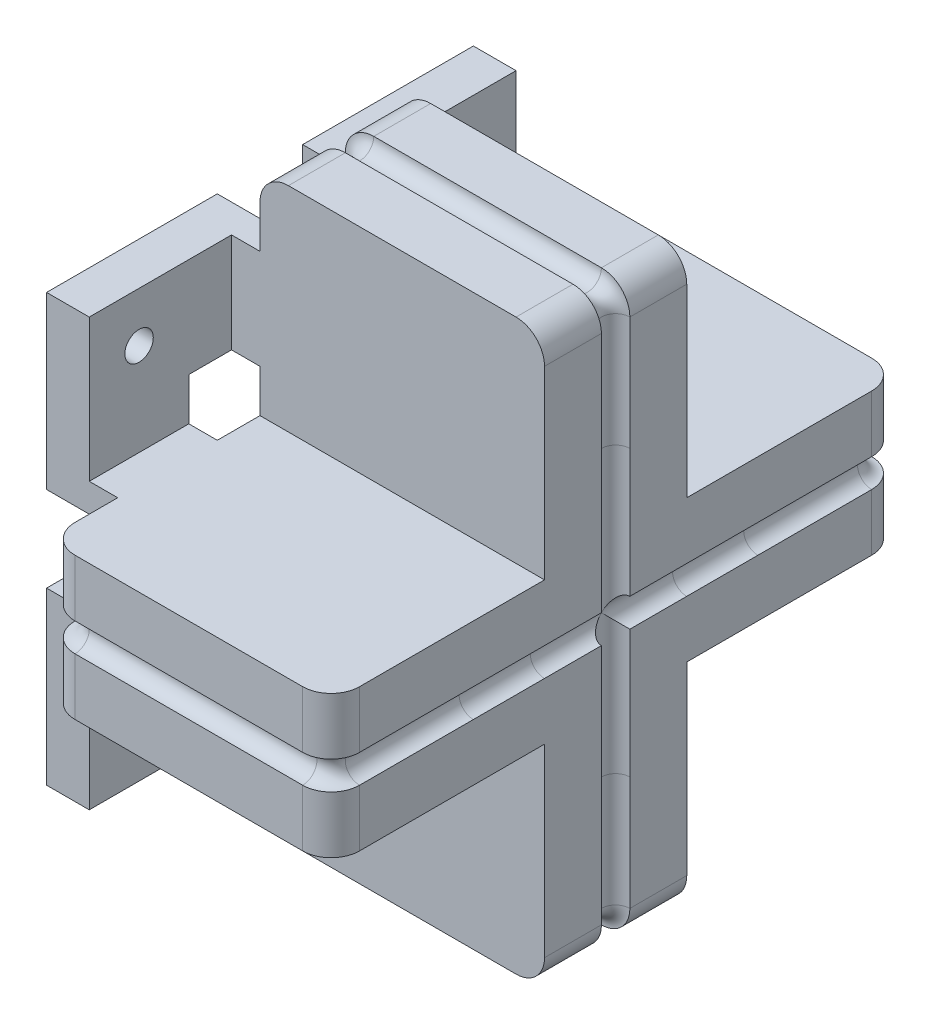
from build123d import *

# Parameters (mm, degrees)
BOSS_EXTRUDE1_DEPTH                   = 5
BOSS_EXTRUDE3_DEPTH                   = 5
SKETCH24_R                            = 1
SKETCH29_R                            = 1
BOSS_EXTRUDE7_REACH                   = 32
BOSS_EXTRUDE7_END_RADIUS              = 1
SKETCH27_R                            = 1
BOSS_EXTRUDE10_REACH                  = 32
BOSS_EXTRUDE10_END_RADIUS             = 1
SKETCH31_R                            = 1
BOSS_EXTRUDE10_DIRECTION_2_REACH      = 32
BOSS_EXTRUDE10_DIRECTION_2_END_RADIUS = 1
BOSS_EXTRUDE11_REACH                  = 32
BOSS_EXTRUDE11_END_RADIUS             = 1
SKETCH32_R                            = 1
SKETCH34_W                            = 7
SKETCH34_H                            = 2
SKETCH34_W_2                          = 2
SKETCH34_H_2                          = 7
BOSS_EXTRUDE12_DEPTH                  = 5
BOSS_EXTRUDE13_DEPTH                  = 3
M1_6_CLEARANCE_HOLE1_D                = 2


with BuildPart() as part:
    # Sketch1 → Boss-Extrude1 (new, symmetric)
    with BuildSketch(Plane.XY):
        with BuildLine():
            Line((8, 20), (0, 20))
            Line((0, 20), (0, -20))
            Line((0, -20), (8, -20))
            ThreePointArc((8, -20), (9.414213562, -19.414213562), (10, -18))
            Line((10, -18), (10, -10))
            Line((10, -10), (10, 10))
            Line((10, 10), (10, 18))
            ThreePointArc((10, 18), (9.414213562, 19.414213562), (8, 20))
        make_face()
    extrude(amount=BOSS_EXTRUDE1_DEPTH, both=True)

    # Sketch26 → Boss-Extrude3 (add, symmetric)
    with BuildSketch(Plane(origin=(0, 0, 0), x_dir=(1, 0, 0), z_dir=(0, 1, 0))):
        with BuildLine():
            Line((0, 20), (0, 5))
            Line((0, 5), (0, -5))
            Line((0, -5), (0, -20))
            Line((0, -20), (8, -20))
            ThreePointArc((8, -20), (9.414213562, -19.414213562), (10, -18))
            Line((10, -18), (10, -10))
            Line((10, -10), (10, -5))
            Line((10, -5), (10, 5))
            Line((10, 5), (10, 10))
            Line((10, 10), (10, 18))
            ThreePointArc((10, 18), (9.414213562, 19.414213562), (8, 20))
            Line((8, 20), (0, 20))
        make_face()
    extrude(amount=BOSS_EXTRUDE3_DEPTH, both=True)

    # Cut-Sweep3: sweep along a path in Sketch1<5>
    with BuildLine(Plane.XY) as cut_sweep3_path:
        Line((0, 20), (0, -20))
        Line((0, -20), (8, -20))
        ThreePointArc((8, -20), (9.414213562, -19.414213562), (10, -18))
        Line((10, -18), (10, -10))
        Line((10, -10), (10, 10))
        Line((10, 10), (10, 18))
        ThreePointArc((10, 18), (9.414213562, 19.414213562), (8, 20))
        Line((8, 20), (0, 20))
    # Sketch24 → Cut-Sweep3 (sweep, cut)
    with BuildSketch(Plane(origin=(0, 0, 0), x_dir=(1, 0, 0), z_dir=(0, 1, 0))):
        with Locations((10, 0)):
            Circle(SKETCH24_R)
    sweep(path=cut_sweep3_path.line, transition=Transition.RIGHT, mode=Mode.SUBTRACT)

    # Cut-Sweep6: sweep along a path in Sketch26<7>
    with BuildLine(Plane(origin=(0, 0, 0), x_dir=(1, 0, 0), z_dir=(0, 1, 0))) as cut_sweep6_path:
        Line((0, 5), (0, 20))
        Line((0, 20), (8, 20))
        ThreePointArc((8, 20), (9.414213562, 19.414213562), (10, 18))
        Line((10, 18), (10, 10))
        Line((10, 10), (10, 5))
        Line((10, 5), (10, -5))
        Line((10, -5), (10, -10))
        Line((10, -10), (10, -18))
        ThreePointArc((10, -18), (9.414213562, -19.414213562), (8, -20))
        Line((8, -20), (0, -20))
        Line((0, -20), (0, -5))
        Line((0, -5), (0, 5))
    # Sketch29 → Cut-Sweep6 (sweep, cut)
    with BuildSketch(Plane.XY):
        with Locations((10, 0)):
            Circle(SKETCH29_R)
    sweep(path=cut_sweep6_path.line, transition=Transition.RIGHT, mode=Mode.SUBTRACT)

    # Mirror1: part across plane


with BuildPart() as part_1:
    add(part.part)
    add(part.part.mirror(Plane(origin=(0, 0, 0), x_dir=(0, 0, 1), z_dir=(1, 0, 0))))

    # Boss-Extrude7: up to this cylinder (the profile starts outside it)
    boss_extrude7_end = Plane(origin=(0, 20, 0), z_dir=(1, 0, 0)) * Cylinder(BOSS_EXTRUDE7_END_RADIUS, 67, mode=Mode.PRIVATE)
    # Sketch27 → Boss-Extrude7 (add, up to the surface)
    with BuildSketch(Plane(origin=(0, 0, 0), x_dir=(1, 0, 0), z_dir=(0, 1, 0)), mode=Mode.PRIVATE) as boss_extrude7_sk1:
        Circle(SKETCH27_R)
    boss_extrude7_tool1 = extrude(boss_extrude7_sk1.sketch, amount=BOSS_EXTRUDE7_REACH, mode=Mode.PRIVATE) - boss_extrude7_end
    add(boss_extrude7_tool1.solids().sort_by_distance((0, 0, 0))[0])

    # Boss-Extrude10: up to this cylinder (the profile starts outside it)
    boss_extrude10_end = Plane(origin=(0, 0, 20), z_dir=(-1, 0, 0)) * Cylinder(BOSS_EXTRUDE10_END_RADIUS, 67, mode=Mode.PRIVATE)
    # Sketch31 → Boss-Extrude10 (add, up to the surface)
    with BuildSketch(Plane.XY, mode=Mode.PRIVATE) as boss_extrude10_sk1:
        Circle(SKETCH31_R)
    boss_extrude10_tool1 = extrude(boss_extrude10_sk1.sketch, amount=BOSS_EXTRUDE10_REACH, mode=Mode.PRIVATE) - boss_extrude10_end
    add(boss_extrude10_tool1.solids().sort_by_distance((0, 0, 0))[0])

    # Boss-Extrude10 direction 2: up to this cylinder (the profile starts outside it)
    boss_extrude10_direction_2_end = Plane(origin=(0, 0, -20), z_dir=(1, 0, 0)) * Cylinder(BOSS_EXTRUDE10_DIRECTION_2_END_RADIUS, 67, mode=Mode.PRIVATE)
    # Sketch31 → Boss-Extrude10 direction 2 (add, up to the surface)
    with BuildSketch(Plane.XY, mode=Mode.PRIVATE) as boss_extrude10_direction_2_sk1:
        Circle(SKETCH31_R)
    boss_extrude10_direction_2_tool1 = extrude(boss_extrude10_direction_2_sk1.sketch, amount=-BOSS_EXTRUDE10_DIRECTION_2_REACH, mode=Mode.PRIVATE) - boss_extrude10_direction_2_end
    add(boss_extrude10_direction_2_tool1.solids().sort_by_distance((0, 0, 0))[0])

    # Boss-Extrude11: up to this cylinder (the profile starts outside it)
    boss_extrude11_end = Plane(origin=(0, -20, 0), z_dir=(1, 0, 0)) * Cylinder(BOSS_EXTRUDE11_END_RADIUS, 67, mode=Mode.PRIVATE)
    # Sketch32 → Boss-Extrude11 (add, up to the surface)
    with BuildSketch(Plane(origin=(0, 0, 0), x_dir=(1, 0, 0), z_dir=(0, 1, 0)), mode=Mode.PRIVATE) as boss_extrude11_sk1:
        Circle(SKETCH32_R)
    boss_extrude11_tool1 = extrude(boss_extrude11_sk1.sketch, amount=-BOSS_EXTRUDE11_REACH, mode=Mode.PRIVATE) - boss_extrude11_end
    add(boss_extrude11_tool1.solids().sort_by_distance((0, 0, 0))[0])

    # Sketch34 → Boss-Extrude12 (add)
    with BuildSketch(Plane.ZY.offset(10)):
        with Locations((11.5, -4)):
            Rectangle(SKETCH34_W, SKETCH34_H)
        with Locations((4, -11.5)):
            Rectangle(SKETCH34_W_2, SKETCH34_H_2)
        with Locations((11.5, 4)):
            Rectangle(SKETCH34_W, SKETCH34_H)
        with Locations((-4, -11.5)):
            Rectangle(SKETCH34_W_2, SKETCH34_H_2)
        with Locations((-11.5, -4)):
            Rectangle(SKETCH34_W, SKETCH34_H)
        with Locations((-11.5, 4)):
            Rectangle(SKETCH34_W, SKETCH34_H)
        with Locations((-4, 11.5)):
            Rectangle(SKETCH34_W_2, SKETCH34_H_2)
        with Locations((4, 11.5)):
            Rectangle(SKETCH34_W_2, SKETCH34_H_2)
    extrude(amount=BOSS_EXTRUDE12_DEPTH)

    # Sketch35 → Boss-Extrude13 (add)
    with BuildSketch(Plane.ZY.offset(15)):
        Polygon((-5, -8), (-8, -8), (-8, -5), (-15, -5), (-15, -8), (-15, -15), (-5, -15), align=None)
        Polygon((8, -5), (15, -5), (15, -15), (8, -15), (5, -15), (5, -8), (8, -8), align=None)
        Polygon((-8, 5), (-8, 8), (-5, 8), (-5, 15), (-8, 15), (-15, 15), (-15, 5), align=None)
        Polygon((5, 8), (8, 8), (8, 5), (15, 5), (15, 8), (15, 15), (5, 15), align=None)
    extrude(amount=-BOSS_EXTRUDE13_DEPTH)

    # M1.6 Clearance Hole1 (through all)
    with Locations(Plane(origin=(-12, 0, 0), x_dir=(0, 0, -1), z_dir=(1, 0, 0))):
        with Locations((-11.5, -11.5), (-11.5, 11.5), (11.5, 11.5), (11.5, -11.5)):
            Hole(M1_6_CLEARANCE_HOLE1_D / 2)


solid = part_1.part
